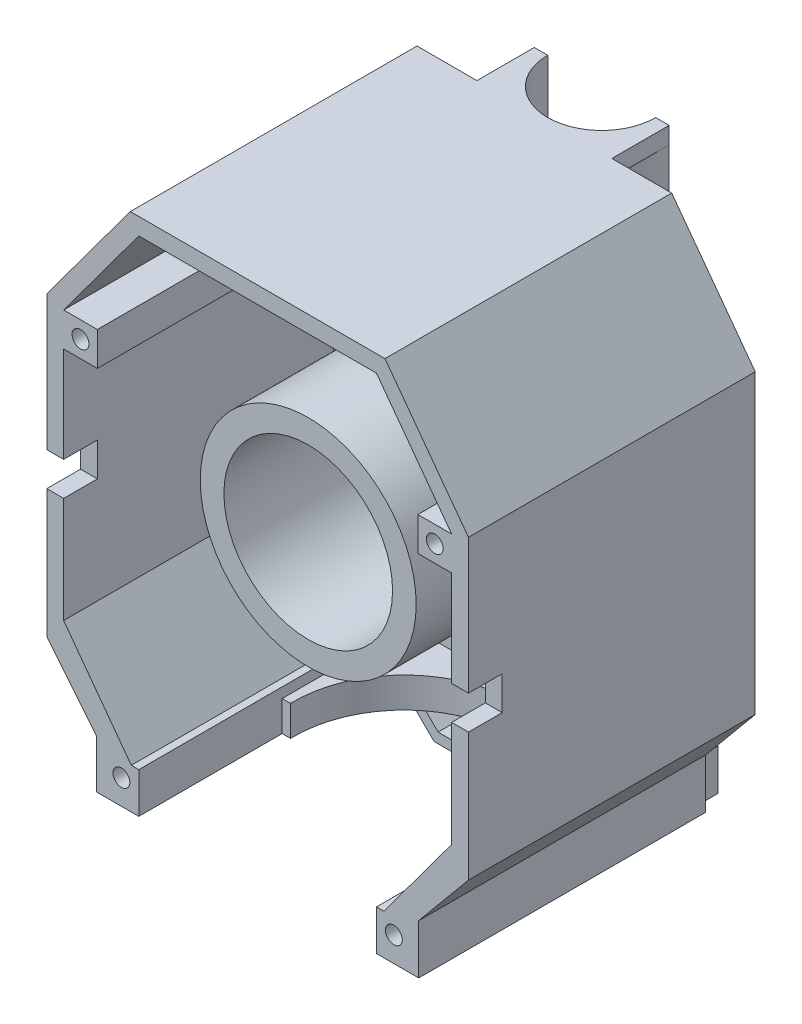
from build123d import *
from build123d.topology import SkipClean

# Parameters (mm, degrees)
ESTRUSIONE_ESTRUSIONE3_DEPTH       = 35
ESTRUSIONE_ESTRUSIONE3_DEPTH_BACK  = 35
SCHIZZO1_R                         = 32
SCHIZZO1_R_2                       = 25
SCHIZZO3D1_R                       = 32
ESTRUSIONE_ESTRUSIONE4_DEPTH       = 5
ESTRUSIONE_ESTRUSIONE13_DEPTH      = 80
TAGLIO_ESTRUSIONE1_START           = -73.5
TAGLIO_ESTRUSIONE1_OUTLINE_R       = 32.75
TAGLIO_ESTRUSIONE1_DEPTH           = 5
TAGLIO_ESTRUSIONE2_DEPTH           = 42.5
ESTRUSIONE_ESTRUSIONE14_DEPTH      = 80
SCHIZZO3D6_R                       = 2.5
TAGLIO_ESTRUSIONE3_DEPTH           = 136.020798627
SCHIZZO3D7_R                       = 4
TAGLIO_ESTRUSIONE4_DEPTH           = 3
TAGLIO_ESTRUSIONE5_DEPTH           = 42.5
TAGLIO_ESTRUSIONE6_DEPTH           = 10
ESTRUSIONE_ESTRUSIONE15_START      = 5
ESTRUSIONE_ESTRUSIONE15_DEPTH      = 5
TAGLIO_ESTRUSIONE7_START           = -3
TAGLIO_ESTRUSIONE7_DEPTH           = 3
TAGLIO_ESTRUSIONE8_START           = 3
TAGLIO_ESTRUSIONE8_DEPTH           = 3
TAGLIO_ESTRUSIONE9_DEPTH           = 10
ESTRUSIONE_ESTRUSIONE16_START      = -35
ESTRUSIONE_ESTRUSIONE16_OUTLINE_R  = 4
ESTRUSIONE_ESTRUSIONE16_DEPTH      = 10
TAGLIO_ESTRUSIONE10_DEPTH          = 80
ESTRUSIONE_ESTRUSIONE17_DEPTH      = 85
TAGLIO_ESTRUSIONE11_DEPTH          = 85
ESTRUSIONE_ESTRUSIONE18_DEPTH      = 85
ESTRUSIONE_ESTRUSIONE19_DEPTH      = 85
ESTRUSIONE_ESTRUSIONE21_DEPTH      = 85
TAGLIO_ESTRUSIONE15_START          = 26
TAGLIO_ESTRUSIONE15_DEPTH          = 26
ESTRUSIONE_ESTRUSIONE22_DEPTH      = 85
SCHIZZO3D26_R                      = 4
TAGLIO_ESTRUSIONE16_DEPTH          = 3
SCHIZZO3D27_R                      = 2.5
TAGLIO_ESTRUSIONE17_DEPTH          = 107
ESTRUSIONE_ESTRUSIONE23_START      = -35
ESTRUSIONE_ESTRUSIONE23_OUTLINE_R  = 25
ESTRUSIONE_ESTRUSIONE23_DEPTH      = 10
ESTRUSIONE_ESTRUSIONE24_DEPTH      = 20
ESTRUSIONE_ESTRUSIONE24_DEPTH_BACK = 20
SCHIZZO3D29_R                      = 5
SCHIZZO3D29_W                      = 10
SCHIZZO3D29_H                      = 17
ESTRUSIONE_ESTRUSIONE26_START      = -39.5
ESTRUSIONE_ESTRUSIONE26_DEPTH      = 113
ESTRUSIONE_ESTRUSIONE27_DEPTH      = 10
ESTRUSIONE_ESTRUSIONE28_START      = 20.5
ESTRUSIONE_ESTRUSIONE28_DEPTH      = 15
ESTRUSIONE_ESTRUSIONE29_START      = -5
ESTRUSIONE_ESTRUSIONE29_DEPTH      = 15
ESTRUSIONE_ESTRUSIONE30_DEPTH      = 10
ESTRUSIONE_ESTRUSIONE30_DEPTH_BACK = 3
ESTRUSIONE_ESTRUSIONE31_START      = -49.5
ESTRUSIONE_ESTRUSIONE31_OUTLINE_W  = 10
ESTRUSIONE_ESTRUSIONE31_OUTLINE_H  = 5
ESTRUSIONE_ESTRUSIONE31_DEPTH      = 10
ESTRUSIONE_ESTRUSIONE31_START_2    = 68.5
ESTRUSIONE_ESTRUSIONE31_2_DEPTH    = 5
TAGLIO_ESTRUSIONE19_DEPTH          = 5
SCHIZZO5_R                         = 5
TAGLIO_ESTRUSIONE20_DEPTH          = 40
ESTRUSIONE_ESTRUSIONE34_DEPTH      = 17
ESTRUSIONE_ESTRUSIONE34_DEPTH_BACK = 5
TAGLIO_ESTRUSIONE21_START          = -52.5
TAGLIO_ESTRUSIONE21_DEPTH          = 8
TAGLIO_ESTRUSIONE22_START          = -52
TAGLIO_ESTRUSIONE22_OUTLINE_W      = 10
TAGLIO_ESTRUSIONE22_OUTLINE_H      = 3
TAGLIO_ESTRUSIONE22_DEPTH          = 5
TAGLIO_ESTRUSIONE23_START          = -52
TAGLIO_ESTRUSIONE23_OUTLINE_W      = 3
TAGLIO_ESTRUSIONE23_OUTLINE_H      = 10
TAGLIO_ESTRUSIONE23_DEPTH          = 5
SCHIZZO7_W                         = 10
SCHIZZO7_H                         = 3
TAGLIO_ESTRUSIONE24_DEPTH          = 17


# Read off the part's stored shape, not the designer's step: Taglio-Estrusione1, Estrusione-Estrusione16, Estrusione-Estrusione23, Estrusione-Estrusione26, Estrusione-Estrusione28, Estrusione-Estrusione31, Taglio-Estrusione21, Taglio-Estrusione22
with BuildPart() as part:
    # Schizzo1 → Estrusione-Estrusione3 (new, two sides: drawn at the far end of the back side and taken through both)
    with BuildSketch(Plane.XY.offset(-ESTRUSIONE_ESTRUSIONE3_DEPTH_BACK)):
        Circle(SCHIZZO1_R)
        Circle(SCHIZZO1_R_2, mode=Mode.SUBTRACT)
    extrude(amount=ESTRUSIONE_ESTRUSIONE3_DEPTH + ESTRUSIONE_ESTRUSIONE3_DEPTH_BACK)

    # Schizzo3D1 → Estrusione-Estrusione4 (add)
    with BuildSketch(Plane(origin=(-62.5, 40, -35), x_dir=(0.6620037592711553, -0.749500515484051, 0), z_dir=(0, 0, 1))):
        Polygon((0, 0), (59.960041239, -52.960300742), (101.452901549, -56.587288919), (104.762920346, -52.839786342), (148.124166578, -3.747502577), (151.434185374, 0), (142.710511148, 40.727263694), (82.750469909, 93.687564436), (41.257609598, 97.314552613), (37.947590802, 93.567050035), (-5.41365543, 44.474766271), (-8.723674227, 40.727263694), align=None)
        with Locations(Location((71.355255574, 20.363631847, 0), (0, 0, 48.547129509))):
            Circle(SCHIZZO3D1_R, mode=Mode.SUBTRACT)
    extrude(amount=ESTRUSIONE_ESTRUSIONE4_DEPTH)

    # Schizzo3D2 → Estrusione-Estrusione13 (add)
    with BuildSketch(Plane(origin=(-37.75, 73.5, -30), x_dir=(0.4568693936855125, -0.889533786381064, 0), z_dir=(0, 0, 1))):
        Polygon((0, 0), (34.493639223, 67.159800872), (75.600538561, 73.870637396), (146.763241471, 37.321085901), (165.255105821, 0), (130.761466598, -67.159800872), (89.654567261, -73.870637396), (18.49186435, -37.321085901), align=None)
        Polygon((22.240991405, -33.625735993), (5.600144509, -0.040454124), (37.788832579, 62.631561059), (74.780971679, 68.67064944), (143.014114416, 33.625735993), (159.654961313, 0.040454124), (127.466273243, -62.631561059), (90.474134143, -68.67064944), align=None, mode=Mode.SUBTRACT)
    extrude(amount=ESTRUSIONE_ESTRUSIONE13_DEPTH)

    # Taglio-Estrusione1 outline → Taglio-Estrusione1 (cut)
    with BuildSketch(Plane(origin=(0, 0, 0), x_dir=(1, 0, 0), z_dir=(0, 1, 0)).offset(TAGLIO_ESTRUSIONE1_START)):
        with Locations((0, -7.5)):
            Circle(TAGLIO_ESTRUSIONE1_OUTLINE_R)
    extrude(amount=TAGLIO_ESTRUSIONE1_DEPTH, mode=Mode.SUBTRACT)

    # Schizzo3D4 → Taglio-Estrusione2 (cut)
    with BuildSketch(Plane(origin=(-32.75, -68.5, 50), x_dir=(0.997099088805763, -0.07611443425998218, 0), z_dir=(0, 0, -1))):
        Polygon((0, 0), (0.380572171, 4.985495444), (65.690562488, 0), (65.309990317, -4.985495444), align=None)
    extrude(amount=TAGLIO_ESTRUSIONE2_DEPTH, mode=Mode.SUBTRACT)

    # Schizzo3D5 → Estrusione-Estrusione14 (add)
    with BuildSketch(Plane(origin=(-57.5, -38.353317087, -30), x_dir=(0.8319168268807552, 0.5549003452446715, 0), z_dir=(0, 0, 1))):
        Polygon((0, 0), (5.549003452, 8.319168269), (13.868171721, 2.770164816), (8.319168269, -5.549003452), align=None)
        Polygon((42.564537786, 63.813539703), (50.883706055, 58.264536251), (45.334702602, 49.945367982), (37.015534334, 55.494371434), align=None)
        Polygon((95.670435091, -63.813539703), (101.219438544, -55.494371434), (92.900270275, -49.945367982), (87.351266822, -58.264536251), align=None)
        Polygon((132.685969425, -8.319168269), (124.366801156, -2.770164816), (129.915804608, 5.549003452), (138.234972877, 0), align=None)
    extrude(amount=ESTRUSIONE_ESTRUSIONE14_DEPTH)

    # Schizzo3D6 → Taglio-Estrusione3 (cut)
    with BuildSketch(Plane(origin=(-52.5, 33.353317087, 50), x_dir=(0.8440673996564301, -0.5362370975951147, 0), z_dir=(0, 0, -1))):
        with Locations(Location((0, 0, 0), (0, 0, 327.572152721))):
            Circle(SCHIZZO3D6_R)
        with Locations(Location((35.7705719, 56.304895247, 0), (0, 0, 327.572152721))):
            Circle(SCHIZZO3D6_R)
        with Locations(Location((124.397648864, 0, 0), (0, 0, 327.572152721))):
            Circle(SCHIZZO3D6_R)
        with Locations(Location((88.627076964, -56.304895247, 0), (0, 0, 327.572152721))):
            Circle(SCHIZZO3D6_R)
    extrude(amount=TAGLIO_ESTRUSIONE3_DEPTH, mode=Mode.SUBTRACT)

    # Schizzo3D7 → Taglio-Estrusione4 (cut)
    with BuildSketch(Plane(origin=(52.5, 33.353317087, -35), x_dir=(-0.8440673996564301, -0.5362370975951145, 0), z_dir=(0, 0, 1))):
        with Locations(Location((0, 0, 0), (0, 0, 147.572152721))):
            Circle(SCHIZZO3D7_R)
        with Locations(Location((35.7705719, 56.304895247, 0), (0, 0, 147.572152721))):
            Circle(SCHIZZO3D7_R)
        with Locations(Location((124.397648864, 0, 0), (0, 0, 147.572152721))):
            Circle(SCHIZZO3D7_R)
        with Locations(Location((88.627076964, -56.304895247, 0), (0, 0, 147.572152721))):
            Circle(SCHIZZO3D7_R)
    extrude(amount=TAGLIO_ESTRUSIONE4_DEPTH, mode=Mode.SUBTRACT)

    # Schizzo3D8 → Taglio-Estrusione5 (cut)
    with BuildSketch(Plane(origin=(-35.227450684, -68.5, 50), x_dir=(0.9974912873801347, -0.07078934666121361, 0), z_dir=(0, 0, -1))):
        Polygon((0, 0), (2.471235472, -0.175377115), (2.825182205, 4.812079322), (0.353946733, 4.987456437), align=None)
        Polygon((70.632097001, 0), (68.160861529, 0.175377115), (67.806914795, -4.812079322), (70.278150268, -4.987456437), align=None)
    extrude(amount=TAGLIO_ESTRUSIONE5_DEPTH, mode=Mode.SUBTRACT)

    # Schizzo3D9 → Taglio-Estrusione6 (cut)
    with BuildSketch(Plane(origin=(-62.5, 0, 50), x_dir=(0.9968152785361251, -0.07974522228289001, 0), z_dir=(0, 0, -1))):
        Polygon((0, 0), (0.797452223, 9.968152785), (5.781528616, 9.569426674), (4.984076393, -0.398726111), align=None)
        Polygon((124.601909817, -9.968152785), (125.39936204, 0), (120.415285647, 0.398726111), (119.617833424, -9.569426674), align=None)
    extrude(amount=TAGLIO_ESTRUSIONE6_DEPTH, mode=Mode.SUBTRACT)

    # Schizzo3D10 → Estrusione-Estrusione15 (add)
    with BuildSketch(Plane(origin=(-32.75, -73.5, 7.5), x_dir=(0.856419201008807, 0, -0.5162810786223304), z_dir=(0, -1, 0)).offset(ESTRUSIONE_ESTRUSIONE15_START)):
        with BuildLine():
            Line((0, 0), (-2.121736335, -1.279060911))
            Line((-2.121736335, -1.279060911), (-24.063682177, 35.118755132))
            Line((-24.063682177, 35.118755132), (-26.224041846, 33.81641065))
            Line((-26.224041846, 33.81641065), (17.659849836, -38.979221436))
            Line((17.659849836, -38.979221436), (82.319499513, 0))
            Line((82.319499513, 0), (38.43560783, 72.795632086))
            Line((38.43560783, 72.795632086), (36.27524816, 71.493287604))
            Line((36.27524816, 71.493287604), (58.217194001, 35.095471561))
            Line((58.217194001, 35.095471561), (56.095457666, 33.81641065))
            ThreePointArc((56.095457666, 33.81641065), (44.955934158, -11.139523508), (0, 0))
        make_face()
    extrude(amount=-ESTRUSIONE_ESTRUSIONE15_DEPTH)

    # Schizzo3D11 → Taglio-Estrusione7 (cut)
    with BuildSketch(Plane(origin=(32.75, -68.5, 7.5), x_dir=(-1, 0, 0), z_dir=(0, 1, 0)).offset(TAGLIO_ESTRUSIONE7_START)):
        with BuildLine():
            Line((0, 0), (-2.477450684, 0))
            ThreePointArc((-2.477450684, 0), (32.75, -35.227450684), (67.977450684, 0))
            Line((67.977450684, 0), (65.5, 0))
            ThreePointArc((65.5, 0), (32.75, -32.75), (0, 0))
        make_face()
    extrude(amount=TAGLIO_ESTRUSIONE7_DEPTH, mode=Mode.SUBTRACT)

    # Schizzo3D12 → Taglio-Estrusione8 (cut)
    with BuildSketch(Plane(origin=(35.227450684, -68.5, 7.5), x_dir=(-0.8827477435104474, 0, -0.46984723190332145), z_dir=(0, -1, 0)).offset(TAGLIO_ESTRUSIONE8_START)):
        with BuildLine():
            Line((0, 0), (17.619271196, 33.103040382))
            Line((17.619271196, 33.103040382), (79.813176398, 0))
            Line((79.813176398, 0), (62.193905202, -33.103040382))
            ThreePointArc((62.193905202, -33.103040382), (14.54543241, -47.648472792), (0, 0))
        make_face()
    extrude(amount=-TAGLIO_ESTRUSIONE8_DEPTH, mode=Mode.SUBTRACT)

    # Schizzo3D13 → Taglio-Estrusione9 (cut)
    with BuildSketch(Plane(origin=(32.75, -78.5, 7.5), x_dir=(-1, 0, 0), z_dir=(0, -1, 0))):
        with BuildLine():
            ThreePointArc((0, 0), (32.75, 32.75), (65.5, 0))
            ThreePointArc((65.5, 0), (32.75, 33.75), (0, 0))
        make_face()
    extrude(amount=-TAGLIO_ESTRUSIONE9_DEPTH, mode=Mode.SUBTRACT)

    # Estrusione-Estrusione16 outline → Estrusione-Estrusione16 (add)
    with BuildSketch(Plane.XY.offset(ESTRUSIONE_ESTRUSIONE16_START)):
        with Locations((52.5, -33.353317087)):
            Circle(ESTRUSIONE_ESTRUSIONE16_OUTLINE_R)
        with Locations((-52.5, -33.353317087)):
            Circle(ESTRUSIONE_ESTRUSIONE16_OUTLINE_R)
    extrude(amount=ESTRUSIONE_ESTRUSIONE16_DEPTH)

    # Schizzo3D15 → Taglio-Estrusione10 (cut)
    with BuildSketch(Plane(origin=(-57.5, -38.353317087, 50), x_dir=(0.9962405881956831, 0.08662961636484198, 0), z_dir=(0, 0, 1))):
        Polygon((0, 0), (0.866296164, 9.962405882), (10.828702046, 9.096109718), (9.962405882, -0.866296164), align=None)
        Polygon((104.605261761, -9.096109718), (105.471557924, 0.866296164), (115.433963806, 0), (114.567667643, -9.962405882), align=None)
    extrude(amount=-TAGLIO_ESTRUSIONE10_DEPTH, mode=Mode.SUBTRACT)

    # Schizzo3D16 → Estrusione-Estrusione17 (add)
    with BuildSketch(Plane(origin=(-62.5, -40, 50), x_dir=(0.9979469235950233, -0.06404637138221654, 0), z_dir=(0, 0, -1))):
        Polygon((0, 0), (0.512370971, 7.983575389), (27.164971657, 36.835808867), (26.8447398, 31.846074249), align=None)
        Polygon((102.163724437, 32.022528861), (101.84349258, 27.032794243), (124.397125498, -7.983575389), (124.909496469, 0), align=None)
    extrude(amount=ESTRUSIONE_ESTRUSIONE17_DEPTH)

    # Schizzo3D17 → Taglio-Estrusione11 (cut)
    with BuildSketch(Plane(origin=(-57.5, -38.353317087, -30), x_dir=(0.9996599089213338, -0.026078084580556556, 0), z_dir=(0, 0, -1))):
        Polygon((0, 0), (0.078234254, 2.998979727), (23.129376621, 32.554584597), (23.051142368, 29.55560487), align=None)
        Polygon((93.560316906, 30.71725572), (93.482082652, 27.718275993), (114.960889526, -2.998979727), (115.03912378, 0), align=None)
    extrude(amount=-TAGLIO_ESTRUSIONE11_DEPTH, mode=Mode.SUBTRACT)

    # Schizzo3D18 → Estrusione-Estrusione18 (add)
    with BuildSketch(Plane(origin=(35.227450684, -78.5, 50), x_dir=(-0.9923639585819584, 0.12334412717087637, 0), z_dir=(0, 0, -1))):
        Polygon((0, 0), (-9.923639586, 1.233441272), (-8.690198314, 11.157080858), (1.233441272, 9.923639586), align=None)
        Polygon((69.916904823, -8.690198314), (79.840544409, -9.923639586), (81.07398568, 0), (71.150346094, 1.233441272), align=None)
    extrude(amount=ESTRUSIONE_ESTRUSIONE18_DEPTH)

    # Schizzo3D21 → Estrusione-Estrusione19 (add)
    with BuildSketch(Plane(origin=(47.227450684, -68.857806459, -35), x_dir=(-0.9924893703590384, -0.12233090257297884, 0), z_dir=(0, 0, -1))):
        Polygon((0, 0), (-0.301502427, 2.446135418), (1.984978741, 0.244661805), (3.164516979, -9.325112791), (92.940045084, 1.740316936), (91.760506845, 11.310091532), (93.443983159, 14.000888755), (93.745485586, 11.554753337), (95.16968563, 0), (1.424200044, -11.554753337), align=None)
    extrude(amount=-ESTRUSIONE_ESTRUSIONE19_DEPTH)

    # Schizzo3D22 → Estrusione-Estrusione21 (add)
    with BuildSketch(Plane(origin=(62.5, -40, 50), x_dir=(-0.5008471058505845, -0.8655357742815103, -1.820429507942214e-15), z_dir=(0, 0, 1))):
        Polygon((0, 0), (0.58023617, -0.065095709), (7.098056235, 3.706477244), (30.493436296, 0), (6.924286194, 4.006776847), align=None)
    extrude(amount=-ESTRUSIONE_ESTRUSIONE21_DEPTH)

    # Schizzo3D23 → Taglio-Estrusione15 (cut)
    with SkipClean():  # the faces are left unmerged after this step: merging them gives an invalid solid
        with BuildSketch(Plane(origin=(35.227450684, -78.5, 50), x_dir=(-0.8562730712113631, 0, -0.5165234046180869), z_dir=(0, -1, 0)).offset(TAGLIO_ESTRUSIONE15_START)):
            with BuildLine():
                Line((0, 0), (21.952244696, 36.391605526))
                Line((21.952244696, 36.391605526), (24.073619002, 35.111944264))
                ThreePointArc((24.073619002, 35.111944264), (69.54922699, 47.095018917), (80.159505166, 1.279661262))
                Line((80.159505166, 1.279661262), (82.280879472, 0))
                Line((82.280879472, 0), (60.328634776, -36.391605526))
                Line((60.328634776, -36.391605526), (0, 0))
            make_face()
        extrude(amount=-TAGLIO_ESTRUSIONE15_DEPTH, mode=Mode.SUBTRACT)

    # Schizzo3D24 → Estrusione-Estrusione22 (add)
    with SkipClean():  # the faces are left unmerged after this step: merging them gives an invalid solid
        with BuildSketch(Plane(origin=(47.75, -80.5, -35), x_dir=(-0.9883033934558069, 0.1525004999458584, 1.4218125797153324e-14), z_dir=(0, 0, 1))):
            Polygon((0, 0), (0.516437262, 0.079689032), (2.667737416, -13.862148816), (2.247271892, -14.563797745), align=None)
            Polygon((96.630245967, 0), (96.017836966, 0.542270865), (93.866536813, 14.484108713), (94.382974075, 14.563797745), align=None)
        extrude(amount=ESTRUSIONE_ESTRUSIONE22_DEPTH)

    # Schizzo3D26 → Taglio-Estrusione16 (cut)
    with SkipClean():  # the faces are left unmerged after this step: merging them gives an invalid solid
        with BuildSketch(Plane(origin=(0, -80.5, -35), x_dir=(0.9837586148440444, 0.1794964838656379, -7.944923026532018e-15), z_dir=(0, 0, 1))):
            with Locations(Location((41.048605807, 0, 0), (0, 0, 349.659567204))):
                Circle(SCHIZZO3D26_R)
            with Locations(Location((-38.403516754, 14.496825156, 0), (0, 0, 349.659567204))):
                Circle(SCHIZZO3D26_R)
        extrude(amount=TAGLIO_ESTRUSIONE16_DEPTH, mode=Mode.SUBTRACT)

    # Schizzo3D27 → Taglio-Estrusione17 (cut)
    with SkipClean():  # the faces are left unmerged after this step: merging them gives an invalid solid
        with BuildSketch(Plane(origin=(0, -80.5, -35), x_dir=(-0.9837586148440446, 0.17949648386563652, 6.761636618325122e-15), z_dir=(0, 0, -1))):
            with Locations(Location((41.048605807, 0, 0), (0, 0, 169.659567204))):
                Circle(SCHIZZO3D27_R)
            with Locations(Location((-38.403516754, 14.496825156, 0), (0, 0, 169.659567204))):
                Circle(SCHIZZO3D27_R)
        extrude(amount=-TAGLIO_ESTRUSIONE17_DEPTH, mode=Mode.SUBTRACT)

    # Estrusione-Estrusione23 outline → Estrusione-Estrusione23 (add)
    with SkipClean():  # the faces are left unmerged after this step: merging them gives an invalid solid
        with BuildSketch(Plane.XY.offset(ESTRUSIONE_ESTRUSIONE23_START)):
            Circle(ESTRUSIONE_ESTRUSIONE23_OUTLINE_R)
        extrude(amount=ESTRUSIONE_ESTRUSIONE23_DEPTH)

    # Schizzo3D29 → Estrusione-Estrusione24 (add, two sides: drawn at the far end of the back side and taken through both)
    with SkipClean():  # the faces are left unmerged after this step: merging them gives an invalid solid
        with BuildSketch(Plane(origin=(0, -39.5, -52), x_dir=(0, 1, 0), z_dir=(1, 0, 0)).offset(-ESTRUSIONE_ESTRUSIONE24_DEPTH_BACK)):
            with Locations(Location((148, 0, 0), (0, 0, 90))):
                Circle(SCHIZZO3D29_R)
            with Locations((-5, 8.5)):
                Rectangle(SCHIZZO3D29_W, SCHIZZO3D29_H)
        extrude(amount=ESTRUSIONE_ESTRUSIONE24_DEPTH + ESTRUSIONE_ESTRUSIONE24_DEPTH_BACK)


with BuildPart() as estrusione_estrusione24_piece_1:
    # of the separate pieces the step leaves, piece 1, a body of its own (estrusione_estrusione24_pieces)
    add(part.part.solids().sort_by_distance((32, 0, 35))[0])

    # Estrusione-Estrusione26 outline → Estrusione-Estrusione26 (add)
    with SkipClean():  # the faces are left unmerged after this step: merging them gives an invalid solid
        with BuildSketch(Plane(origin=(0, 0, 0), x_dir=(1, 0, 0), z_dir=(0, 1, 0)).offset(ESTRUSIONE_ESTRUSIONE26_START)):
            with BuildLine():
                Line((-16, 52), (-20, 52))
                ThreePointArc((-20, 52), (-17.474453855, 42.271512837), (-10.535653753, 35))
                Line((-10.535653753, 35), (10.535653753, 35))
                ThreePointArc((10.535653753, 35), (17.474453855, 42.271512837), (20, 52))
                Line((20, 52), (16, 52))
                ThreePointArc((16, 52), (0, 36), (-16, 52))
            make_face()
        extrude(amount=ESTRUSIONE_ESTRUSIONE26_DEPTH)

    # Schizzo3D31 → Estrusione-Estrusione27 (add)
    with SkipClean():  # the faces are left unmerged after this step: merging them gives an invalid solid
        with BuildSketch(Plane(origin=(20, 20.5, -52), x_dir=(-0.9203309184584747, 0, 0.3911406403448515), z_dir=(0, -1, 0))):
            with BuildLine():
                Line((0, 0), (6.649390886, -15.645625614))
                Line((6.649390886, -15.645625614), (15.35972136, -11.943735162))
                ThreePointArc((15.35972136, -11.943735162), (6.129544902, -7.965583789), (0, 0))
            make_face()
            with BuildLine():
                Line((36.813236738, 15.645625614), (43.462627624, 0))
                Line((43.462627624, 0), (34.75229715, -3.701890452))
                ThreePointArc((34.75229715, -3.701890452), (38.294105233, 5.704354352), (36.813236738, 15.645625614))
            make_face()
        extrude(amount=-ESTRUSIONE_ESTRUSIONE27_DEPTH)

    # Estrusione-Estrusione28 outline → Estrusione-Estrusione28 (add)
    with SkipClean():  # the faces are left unmerged after this step: merging them gives an invalid solid
        with BuildSketch(Plane(origin=(0, 0, 0), x_dir=(1, 0, 0), z_dir=(0, 1, 0)).offset(ESTRUSIONE_ESTRUSIONE28_START)):
            with BuildLine():
                Line((-14, 52), (-16, 52))
                ThreePointArc((-16, 52), (0, 36), (16, 52))
                Line((16, 52), (14, 52))
                ThreePointArc((14, 52), (0, 38), (-14, 52))
            make_face()
        extrude(amount=ESTRUSIONE_ESTRUSIONE28_DEPTH)

    # Schizzo3D33 → Estrusione-Estrusione29 (add)
    with SkipClean():  # the faces are left unmerged after this step: merging them gives an invalid solid
        with BuildSketch(Plane(origin=(-20, 20.5, -52), x_dir=(0, 0.8944271909999161, 0.44721359549995776), z_dir=(-1, 0, 0)).offset(ESTRUSIONE_ESTRUSIONE29_START)):
            Polygon((0, 0), (8.94427191, 4.472135955), (11.180339887, 0), (2.236067977, -4.472135955), align=None)
        estrusione_estrusione29 = extrude(amount=ESTRUSIONE_ESTRUSIONE29_DEPTH)

    # Specchia1: Estrusione-Estrusione29 across plane
    with SkipClean():  # the faces are left unmerged after this step: merging them gives an invalid solid
        add(estrusione_estrusione29.mirror(Plane(origin=(0, 0, 0), x_dir=(0, 0, 1), z_dir=(1, 0, 0))))

    # Schizzo3D34 → Estrusione-Estrusione30 (add, two sides: drawn at the far end of the back side and taken through both)
    with SkipClean():  # the faces are left unmerged after this step: merging them gives an invalid solid
        with BuildSketch(Plane(origin=(-20, -49.5, -52), x_dir=(0, 0.8944271909999161, 0.44721359549995776), z_dir=(-1, 0, 0)).offset(-ESTRUSIONE_ESTRUSIONE30_DEPTH_BACK)):
            Polygon((0, 0), (8.94427191, 4.472135955), (11.180339887, 0), (2.236067977, -4.472135955), align=None)
        extrude(amount=ESTRUSIONE_ESTRUSIONE30_DEPTH + ESTRUSIONE_ESTRUSIONE30_DEPTH_BACK)

    # Estrusione-Estrusione31 outline → Estrusione-Estrusione31 (add)
    with SkipClean():  # the faces are left unmerged after this step: merging them gives an invalid solid
        with BuildSketch(Plane(origin=(0, 0, 0), x_dir=(1, 0, 0), z_dir=(0, 1, 0)).offset(ESTRUSIONE_ESTRUSIONE31_START)):
            with Locations((25, 49.5)):
                Rectangle(ESTRUSIONE_ESTRUSIONE31_OUTLINE_W, ESTRUSIONE_ESTRUSIONE31_OUTLINE_H)
        extrude(amount=ESTRUSIONE_ESTRUSIONE31_DEPTH)

    # Estrusione-Estrusione31 2 outline → Estrusione-Estrusione31 2 (add)
    with SkipClean():  # the faces are left unmerged after this step: merging them gives an invalid solid
        with BuildSketch(Plane(origin=(0, 0, 0), x_dir=(1, 0, 0), z_dir=(0, 1, 0)).offset(ESTRUSIONE_ESTRUSIONE31_START_2)):
            with BuildLine():
                ThreePointArc((-10.535653753, 35), (-17.474453855, 42.271512837), (-20, 52))
                Line((-20, 52), (-20, 35))
                Line((-20, 35), (-10.535653753, 35))
            make_face()
            with BuildLine():
                Line((20, 35), (20, 52))
                ThreePointArc((20, 52), (17.474453855, 42.271512837), (10.535653753, 35))
                Line((10.535653753, 35), (20, 35))
            make_face()
        extrude(amount=ESTRUSIONE_ESTRUSIONE31_2_DEPTH)

    # Schizzo4 → Taglio-Estrusione19 (cut)
    with SkipClean():  # the faces are left unmerged after this step: merging them gives an invalid solid
        with BuildSketch(Plane(origin=(0, -39.5, 0), x_dir=(1, 0, 0), z_dir=(0, 1, 0))):
            with BuildLine():
                Line((-16, 52), (16, 52))
                ThreePointArc((16, 52), (0, 36), (-16, 52))
            make_face()
        extrude(amount=-TAGLIO_ESTRUSIONE19_DEPTH, mode=Mode.SUBTRACT)

    # Schizzo6 → Estrusione-Estrusione34 (add, two sides: drawn at the far end of the back side and taken through both)
    with SkipClean():  # the faces are left unmerged after this step: merging them gives an invalid solid
        with BuildSketch(Plane(origin=(0, 0, -35), x_dir=(-1, 0, 0), z_dir=(0, 0, -1)).offset(-ESTRUSIONE_ESTRUSIONE34_DEPTH_BACK)):
            Polygon((0, -49.5), (-27.742640687, -49.5), (-34.5, -56.257359313), (-34.5, -90.742640687), (-27.742640687, -97.5), (27.742640687, -97.5), (34.5, -90.742640687), (34.5, -56.257359313), (27.742640687, -49.5), align=None)
            Polygon((0, -52.5), (-26.5, -52.5), (-31.5, -57.5), (-31.5, -89.5), (-26.5, -94.5), (26.5, -94.5), (31.5, -89.5), (31.5, -57.5), (26.5, -52.5), align=None, mode=Mode.SUBTRACT)
        extrude(amount=ESTRUSIONE_ESTRUSIONE34_DEPTH + ESTRUSIONE_ESTRUSIONE34_DEPTH_BACK)

    # Taglio-Estrusione21 outline → Taglio-Estrusione21 (cut)
    with SkipClean():  # the faces are left unmerged after this step: merging them gives an invalid solid
        with BuildSketch(Plane(origin=(0, 0, 0), x_dir=(1, 0, 0), z_dir=(0, 1, 0)).offset(TAGLIO_ESTRUSIONE21_START)):
            with BuildLine():
                ThreePointArc((-5, 52), (0, 47), (5, 52))
                Line((5, 52), (-5, 52))
            make_face()
        extrude(amount=TAGLIO_ESTRUSIONE21_DEPTH, mode=Mode.SUBTRACT)

    # Taglio-Estrusione22 outline → Taglio-Estrusione22 (cut)
    with SkipClean():  # the faces are left unmerged after this step: merging them gives an invalid solid
        with BuildSketch(Plane.XY.offset(TAGLIO_ESTRUSIONE22_START)):
            with Locations((0, -96)):
                Rectangle(TAGLIO_ESTRUSIONE22_OUTLINE_W, TAGLIO_ESTRUSIONE22_OUTLINE_H)
        extrude(amount=TAGLIO_ESTRUSIONE22_DEPTH, mode=Mode.SUBTRACT)

    # Taglio-Estrusione23 outline → Taglio-Estrusione23 (cut)
    with SkipClean():  # the faces are left unmerged after this step: merging them gives an invalid solid
        with BuildSketch(Plane.XY.offset(TAGLIO_ESTRUSIONE23_START)):
            with Locations((33, -73.5)):
                Rectangle(TAGLIO_ESTRUSIONE23_OUTLINE_W, TAGLIO_ESTRUSIONE23_OUTLINE_H)
            with Locations((-33, -73.5)):
                Rectangle(TAGLIO_ESTRUSIONE23_OUTLINE_W, TAGLIO_ESTRUSIONE23_OUTLINE_H)
        extrude(amount=TAGLIO_ESTRUSIONE23_DEPTH, mode=Mode.SUBTRACT)

    # Schizzo7 → Taglio-Estrusione24 (cut)
    with SkipClean():  # the faces are left unmerged after this step: merging them gives an invalid solid
        with BuildSketch(Plane(origin=(0, 0, -52), x_dir=(-1, 0, 0), z_dir=(0, 0, -1))):
            with Locations((0, -51)):
                Rectangle(SCHIZZO7_W, SCHIZZO7_H)
        extrude(amount=-TAGLIO_ESTRUSIONE24_DEPTH, mode=Mode.SUBTRACT)


with BuildPart() as estrusione_estrusione24_piece_2:
    # of the separate pieces the step leaves, piece 2, a body of its own (estrusione_estrusione24_pieces)
    add(part.part.solids().sort_by_distance((0, 108.5, -47))[0])

    # Schizzo5 → Taglio-Estrusione20 (cut)
    with BuildSketch(Plane.ZY.offset(20)):
        with Locations((-52, 108.5)):
            Circle(SCHIZZO5_R)
    extrude(amount=-TAGLIO_ESTRUSIONE20_DEPTH, mode=Mode.SUBTRACT)


solid = estrusione_estrusione24_piece_1.part
